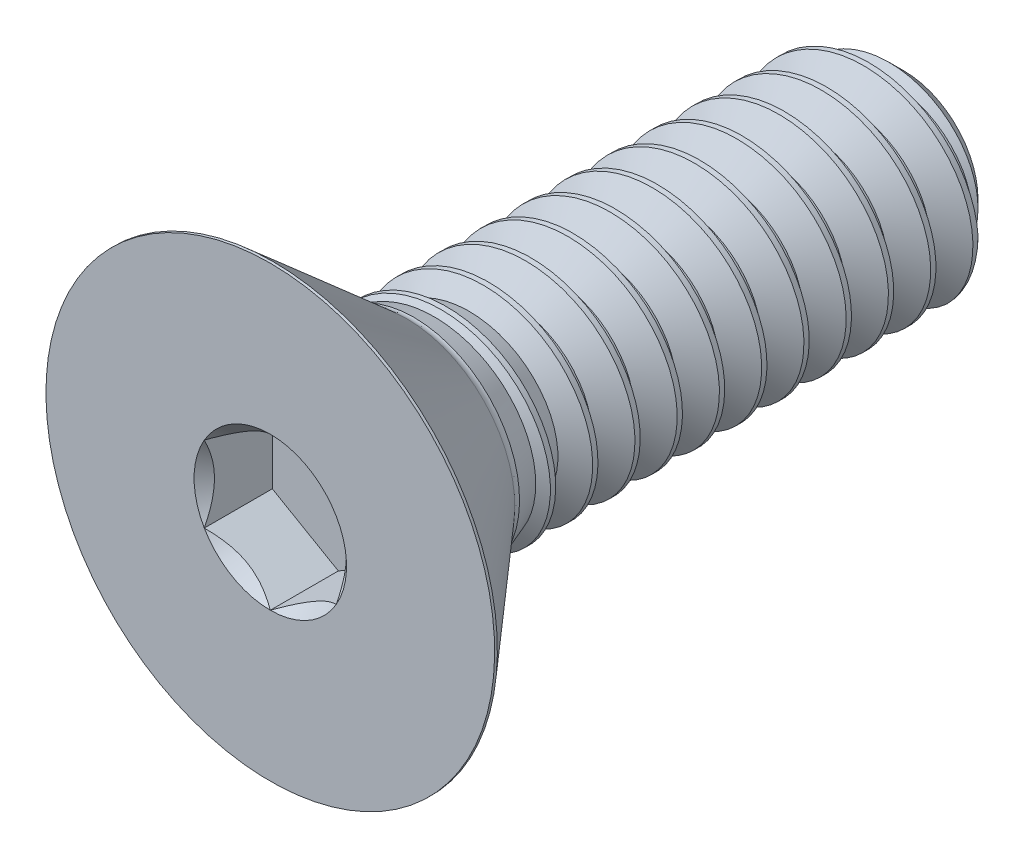
from build123d import *

# Parameters (mm, degrees)
SKETCH10_R         = 2.291358881
CUT_EXTRUDE2_DEPTH = 2.0447
CUT_EXTRUDE2_DRAFT = -45
CUT_EXTRUDE1_DEPTH = 2.0447
CUT_SWEEP1_PITCH   = 1.27
CUT_SWEEP1_TO      = 14.733428


with BuildPart() as part:
    # Sketch11 → Revolve1 (revolve)
    with BuildSketch(Plane(origin=(0, 0, 0), x_dir=(0, 0, -1), z_dir=(1, 0, 0))):
        with BuildLine():
            Line((-9.443212, 6.7437), (-5.4356, 3.259936038))
            ThreePointArc((-5.4356, 3.259936038), (-5.329693592, 3.196928347), (-5.208428247, 3.175))
            Line((-5.208428247, 3.175), (8.5725, 3.175))
            Line((8.5725, 3.175), (9.525, 2.2225))
            Line((9.525, 2.2225), (9.525, 0))
            Line((9.525, 0), (-9.525, 0))
            Line((-9.525, 0), (-9.525, 6.7437))
            Line((-9.525, 6.7437), (-9.443212, 6.7437))
        make_face()
    revolve(axis=Axis((0, 0, -9.525), (0, 0, 1)))


with BuildPart() as cut_extrude2_tool:
    # Sketch10 → Cut-Extrude2 (with draft: the straight prism first)
    with BuildSketch(Plane.XY.offset(9.525)):
        Circle(SKETCH10_R)
    extrude(amount=-CUT_EXTRUDE2_DEPTH)
    # Cut-Extrude2: the draft: its side faces are tilted about the plane it starts from
    cut_extrude2_sides = [cut_extrude2_tool.faces().sort_by_distance(p)[0] for p in [
        (-2.291358881, 0, 8.50265),
    ]]
    draft(cut_extrude2_sides, Plane.XY.offset(9.525), CUT_EXTRUDE2_DRAFT)


with BuildPart() as part_1:
    add(part.part)

    # Cut-Extrude2: cut by cut_extrude2_tool
    add(cut_extrude2_tool.part, mode=Mode.SUBTRACT)

    # Sketch9 → Cut-Extrude1 (cut)
    with BuildSketch(Plane.XY.offset(9.525)):
        Polygon((1.984375, -1.14567944), (1.984375, 1.14567944), (0, 2.291358881), (-1.984375, 1.14567944), (-1.984375, -1.14567944), (0, -2.291358881), align=None)
    extrude(amount=-CUT_EXTRUDE1_DEPTH, mode=Mode.SUBTRACT)


with BuildPart() as body_2:
    # Split1: the piece on the far side of the plane
    add(part_1.part)
    split(bisect_by=Plane.XY.offset(5.208428247), keep=Keep.BOTTOM)

    # Cut-Sweep1: arcs per turn and ends read off the stored shape
    # Cut-Sweep1: the profile of Sketch4 screwed along a right-hand helix through 15 turns, 8 arcs to a turn; built about Z, then put on its axis
    cut_sweep1_z = Axis((0, 0, 0), (0, 0, 1))
    cut_sweep1_corners = [(3.243740766, 0, 0.0396875), (3.243740766, 0, -1.1509375), (2.350110803, 0, -0.635), (2.350110803, 0, -0.47625)]
    with BuildLine(mode=Mode.PRIVATE) as cut_sweep1_profile:
        Line(cut_sweep1_corners[0], cut_sweep1_corners[1])
        Line(cut_sweep1_corners[1], cut_sweep1_corners[2])
        Line(cut_sweep1_corners[2], cut_sweep1_corners[3])
        Line(cut_sweep1_corners[3], cut_sweep1_corners[0])
    cut_sweep1_cap = Face(cut_sweep1_profile.wire())
    cut_sweep1_turn_angles = [0, 22.5, 45, 67.5, 90, 112.5, 135, 157.5, 180, 202.5, 225, 247.5, 270, 292.5, 315, 337.5, 360]
    cut_sweep1_turn_weights = [1, 0.9238795325112867, 1, 0.9238795325112867, 1, 0.9238795325112867, 1, 0.9238795325112867, 1, 0.9238795325112867, 1, 0.9238795325112867, 1, 0.9238795325112867, 1, 0.9238795325112867, 1]
    cut_sweep1_turn_rails = [Edge.make_bspline([Vector(p[0], p[1], 0).rotate(cut_sweep1_z, cut_sweep1_turn_angles[k]) / cut_sweep1_turn_weights[k] + Vector(0, 0, p[2] + CUT_SWEEP1_PITCH * cut_sweep1_turn_angles[k] / 360) for k in range(17)], [0, 0, 0, 1, 1, 2, 2, 3, 3, 4, 4, 5, 5, 6, 6, 7, 7, 8, 8, 8], 2, cut_sweep1_turn_weights) for p in cut_sweep1_corners]
    cut_sweep1_turn_sides = [Face.make_surface_from_curves(cut_sweep1_turn_rails[p[0]], cut_sweep1_turn_rails[p[1]]) for p in [(0, 1), (1, 2), (2, 3), (3, 0)]]
    cut_sweep1 = Plane(origin=(0, 0, -9.525), x_dir=(0, 1, 0), z_dir=(0, 0, 1)) * split(Solid(Shell([*[p.moved(Location((0, 0, CUT_SWEEP1_PITCH * i))) for i in range(15) for p in cut_sweep1_turn_sides], cut_sweep1_cap, cut_sweep1_cap.rotate(cut_sweep1_z, 5400).moved(Location((0, 0, CUT_SWEEP1_PITCH * 5400 / 360)))])), bisect_by=Plane.XY.offset(CUT_SWEEP1_TO), keep=Keep.BOTTOM, mode=Mode.PRIVATE)
    add(cut_sweep1, mode=Mode.SUBTRACT)


with BuildPart() as part_2:
    add(part_1.part)

    # Split1
    split(bisect_by=Plane.XY.offset(5.208428247), keep=Keep.TOP)

    add(body_2.part)  # Boss-Extrude2 merges body 2
    # Boss-Extrude2 cone 1 section (through the dimple's axis) → Boss-Extrude2 (revolve)
    with BuildSketch(Plane(origin=(0, 0, 5.208428247), x_dir=(0, -1, 0), z_dir=(1, 0, 0))):
        Polygon((0, 0), (3.175, 0), (0, 8.723240807), align=None)
    revolve(axis=Axis((0, 0, 5.208428247), (0, 0, -1)))


solid = part_2.part
